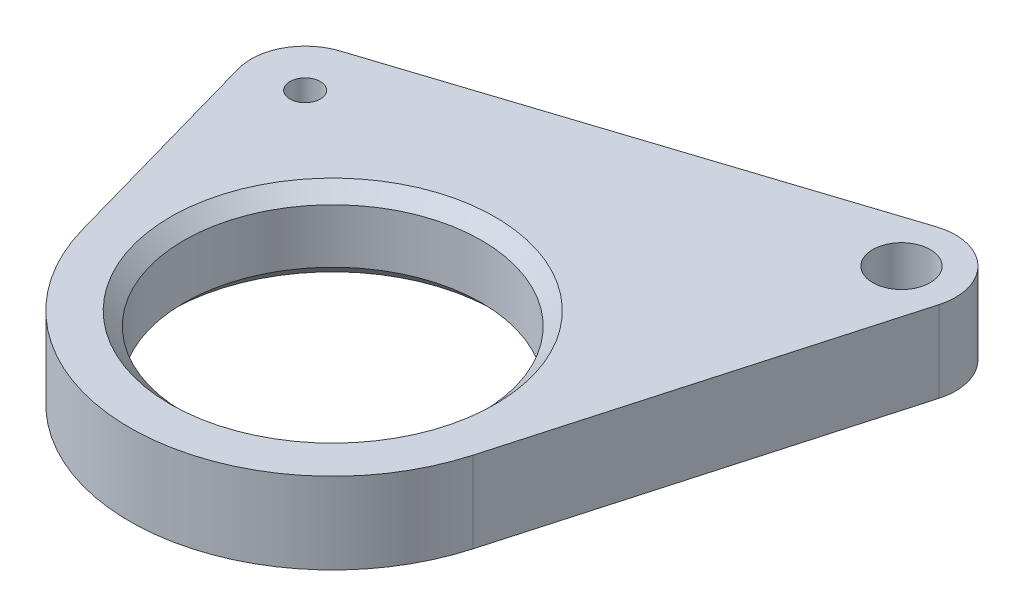
from build123d import *

# Parameters (mm, degrees)
SKETCH1_R           = 11
SKETCH1_R_2         = 1.125
SKETCH1_R_3         = 2.125
BOSS_EXTRUDE1_DEPTH = 6
CHAMFER1_SIZE       = 1


with BuildPart() as part:
    # Sketch1 → Boss-Extrude1 (new body)
    with BuildSketch(Plane(origin=(0, 0, 0), x_dir=(1, 0, 0), z_dir=(0, 1, 0))):
        with BuildLine():
            Line((-14.435425012, -4.076580028), (-18.974912412, 11.998028961))
            ThreePointArc((-18.974912412, 11.998028961), (-18.652621929, 14.97169303), (-16.358089184, 16.890460507))
            Line((-16.358089184, 16.890460507), (16.938666783, 27.675915622))
            ThreePointArc((16.938666783, 27.675915622), (20.945441007, 26.752253439), (22.020736895, 22.783484075))
            Line((22.020736895, 22.783484075), (14.435425012, -4.076580028))
            ThreePointArc((14.435425012, -4.076580028), (0, -15), (-14.435425012, -4.076580028))
        make_face()
        Circle(SKETCH1_R, mode=Mode.SUBTRACT)
        with Locations((-15.125465743, 13.085116968)):
            Circle(SKETCH1_R_2, mode=Mode.SUBTRACT)
        with Locations((18.171290225, 23.870572083)):
            Circle(SKETCH1_R_3, mode=Mode.SUBTRACT)
    extrude(amount=BOSS_EXTRUDE1_DEPTH)

    # Chamfer1
    chamfer1_edges = [part.edges().sort_by_distance(p)[0] for p in [
        (-11, 0, 0),
        (-11, 6, 0),
    ]]
    chamfer(chamfer1_edges, length=CHAMFER1_SIZE)


solid = part.part
